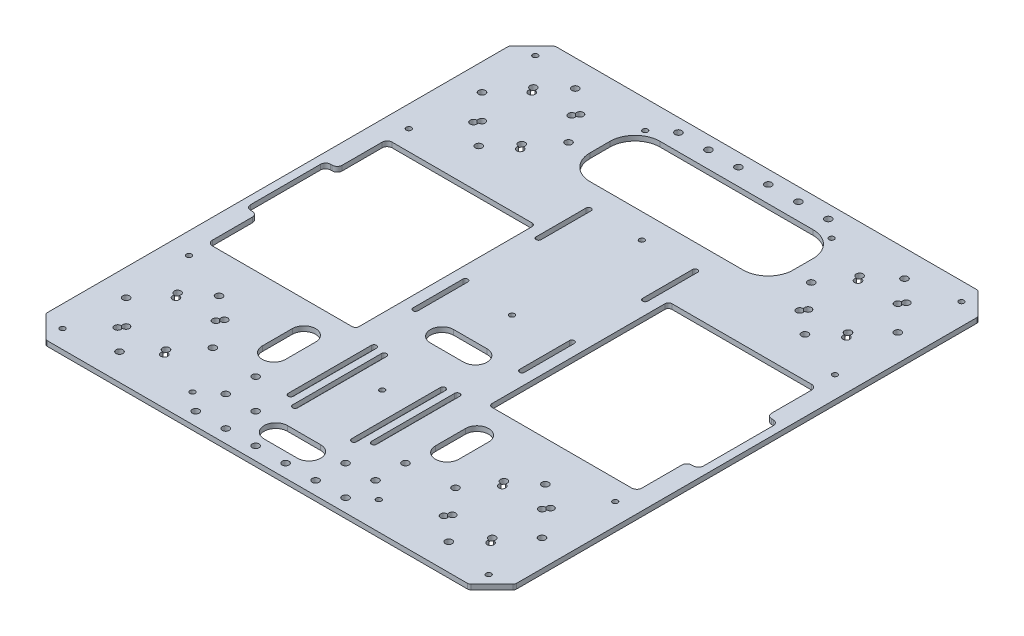
from build123d import *

# Parameters (mm, degrees)
BASE_FLANGE1_START = -3
BASE_FLANGE1_DEPTH = 3
SKETCH6_R          = 1.55
SKETCH6_R_2        = 2.05
CUT_EXTRUDE1_DEPTH = 10
FILLET1_R          = 3
SKETCH7_R          = 2.05
CUT_EXTRUDE2_DEPTH = 10


# Read off the part's stored shape, not the designer's step: Base-Flange1
with BuildPart() as part:
    # Base-Flange1 outline → Base-Flange1 (new body)
    with BuildSketch(Plane(origin=(0, 0, 0), x_dir=(1, 0, 0), z_dir=(0, 1, 0)).offset(BASE_FLANGE1_START)):
        with BuildLine():
            Line((140.314213562, 139.644870145), (127.644870145, 152.314213562))
            ThreePointArc((127.644870145, 152.314213562), (126.996023447, 152.747759065), (126.230656582, 152.9))
            Line((126.230656582, 152.9), (-126.230656582, 152.9))
            ThreePointArc((-126.230656582, 152.9), (-126.996023447, 152.747759065), (-127.644870145, 152.314213562))
            Line((-127.644870145, 152.314213562), (-140.314213562, 139.644870145))
            ThreePointArc((-140.314213562, 139.644870145), (-140.747759065, 138.996023447), (-140.9, 138.230656582))
            Line((-140.9, 138.230656582), (-140.9, -138.230656582))
            ThreePointArc((-140.9, -138.230656582), (-140.747759065, -138.996023447), (-140.314213562, -139.644870145))
            Line((-140.314213562, -139.644870145), (-127.644870145, -152.314213562))
            ThreePointArc((-127.644870145, -152.314213562), (-126.996023447, -152.747759065), (-126.230656582, -152.9))
            Line((-126.230656582, -152.9), (126.230656582, -152.9))
            ThreePointArc((126.230656582, -152.9), (126.996023447, -152.747759065), (127.644870145, -152.314213562))
            Line((127.644870145, -152.314213562), (140.314213562, -139.644870145))
            ThreePointArc((140.314213562, -139.644870145), (140.747759065, -138.996023447), (140.9, -138.230656582))
            Line((140.9, -138.230656582), (140.9, 138.230656582))
            ThreePointArc((140.9, 138.230656582), (140.747759065, 138.996023447), (140.314213562, 139.644870145))
        make_face()
        with BuildLine():
            ThreePointArc((-42, 54), (-40.585786438, 53.414213562), (-40, 52))
            Line((-40, 52), (-40, -52))
            ThreePointArc((-40, -52), (-40.585786438, -53.414213562), (-42, -54))
            Line((-42, -54), (-129, -54))
            Line((-129, -54), (-129, -24))
            Line((-129, -24), (-136, -24))
            Line((-136, -24), (-136, 24))
            Line((-136, 24), (-129, 24))
            Line((-129, 24), (-129, 54))
            Line((-129, 54), (-42, 54))
        make_face(mode=Mode.SUBTRACT)
        with BuildLine():
            ThreePointArc((40, 52), (40.585786438, 53.414213562), (42, 54))
            Line((42, 54), (129, 54))
            Line((129, 54), (129, 24))
            Line((129, 24), (136, 24))
            Line((136, 24), (136, -24))
            Line((136, -24), (129, -24))
            Line((129, -24), (129, -54))
            Line((129, -54), (42, -54))
            ThreePointArc((42, -54), (40.585786438, -53.414213562), (40, -52))
            Line((40, -52), (40, 52))
        make_face(mode=Mode.SUBTRACT)
    extrude(amount=BASE_FLANGE1_DEPTH)

    # Sketch6 → Cut-Extrude1 (cut)
    with BuildSketch(Plane(origin=(0, 0, 0), x_dir=(1, 0, 0), z_dir=(0, 1, 0))):
        with Locations(Location((128, 142, 0), (0, 0, 270))):
            Circle(SKETCH6_R)
        with Locations(Location((56, 136, 0), (0, 0, 270))):
            Circle(SKETCH6_R)
        with Locations(Location((128, 66, 0), (0, 0, 270))):
            Circle(SKETCH6_R)
        with Locations(Location((0, 78, 0), (0, 0, 270))):
            Circle(SKETCH6_R)
        with Locations(Location((128, -142, 0), (0, 0, 270))):
            Circle(SKETCH6_R)
        with Locations(Location((128, -66, 0), (0, 0, 270))):
            Circle(SKETCH6_R)
        with Locations(Location((56, -136, 0), (0, 0, 270))):
            Circle(SKETCH6_R)
        with Locations(Location((0, -78, 0), (0, 0, 270))):
            Circle(SKETCH6_R)
        with Locations(Location((-56, -136, 0), (0, 0, 270))):
            Circle(SKETCH6_R)
        with Locations(Location((-128, -66, 0), (0, 0, 270))):
            Circle(SKETCH6_R)
        with Locations(Location((-128, -142, 0), (0, 0, 270))):
            Circle(SKETCH6_R)
        with Locations(Location((-128, 66, 0), (0, 0, 270))):
            Circle(SKETCH6_R)
        with Locations(Location((-56, 136, 0), (0, 0, 270))):
            Circle(SKETCH6_R)
        with Locations(Location((-128, 142, 0), (0, 0, 270))):
            Circle(SKETCH6_R)
        with Locations(Location((0, 0, 0), (0, 0, 270))):
            Circle(SKETCH6_R)
        with Locations(Location((-98, 78, 0), (0, 0, 270))):
            Circle(SKETCH6_R_2)
        with Locations(Location((-72.9, 106.869078783, 0), (0, 0, 270))):
            Circle(SKETCH6_R_2)
        with Locations(Location((-124.9, 106.869078783, 0), (0, 0, 270))):
            Circle(SKETCH6_R_2)
        with Locations(Location((124.9, 106.869078783, 0), (0, 0, 270))):
            Circle(SKETCH6_R_2)
        with Locations(Location((72.9, 106.869078783, 0), (0, 0, 270))):
            Circle(SKETCH6_R_2)
        with Locations(Location((98, 78, 0), (0, 0, 270))):
            Circle(SKETCH6_R_2)
        with Locations(Location((-124.9, -106.869078783, 0), (0, 0, 270))):
            Circle(SKETCH6_R_2)
        with Locations(Location((-98, -78, 0), (0, 0, 270))):
            Circle(SKETCH6_R_2)
        with Locations(Location((-72.9, -106.869078783, 0), (0, 0, 270))):
            Circle(SKETCH6_R_2)
        with Locations(Location((72.9, -106.869078783, 0), (0, 0, 270))):
            Circle(SKETCH6_R_2)
        with Locations(Location((98, -78, 0), (0, 0, 270))):
            Circle(SKETCH6_R_2)
        with Locations(Location((124.9, -106.869078783, 0), (0, 0, 270))):
            Circle(SKETCH6_R_2)
        with Locations(Location((-98.9, 136.9, 0), (0, 0, 270))):
            Circle(SKETCH6_R_2)
        with Locations(Location((98.9, 136.9, 0), (0, 0, 270))):
            Circle(SKETCH6_R_2)
        with Locations(Location((98.9, -136.9, 0), (0, 0, 270))):
            Circle(SKETCH6_R_2)
        with Locations(Location((-98.9, -136.9, 0), (0, 0, 270))):
            Circle(SKETCH6_R_2)
        with BuildLine():
            Line((-46, 92.9), (46, 92.9))
            ThreePointArc((46, 92.9), (56.606601718, 97.293398282), (61, 107.9))
            Line((61, 107.9), (61, 119.9))
            ThreePointArc((61, 119.9), (56.606601718, 130.506601718), (46, 134.9))
            Line((46, 134.9), (-46, 134.9))
            ThreePointArc((-46, 134.9), (-56.606601718, 130.506601718), (-61, 119.9))
            Line((-61, 119.9), (-61, 107.9))
            ThreePointArc((-61, 107.9), (-56.606601718, 97.293398282), (-46, 92.9))
        make_face()
        with BuildLine():
            Line((-30.5, 78), (-30.5, 48))
            ThreePointArc((-30.5, 48), (-32, 46.5), (-33.5, 48))
            Line((-33.5, 48), (-33.5, 78))
            ThreePointArc((-33.5, 78), (-32, 79.5), (-30.5, 78))
        make_face()
        with BuildLine():
            Line((30.5, 78), (30.5, 48))
            ThreePointArc((30.5, 48), (32, 46.5), (33.5, 48))
            Line((33.5, 48), (33.5, 78))
            ThreePointArc((33.5, 78), (32, 79.5), (30.5, 78))
        make_face()
        with BuildLine():
            Line((-30.5, 4), (-30.5, -26))
            ThreePointArc((-30.5, -26), (-32, -27.5), (-33.5, -26))
            Line((-33.5, -26), (-33.5, 4))
            ThreePointArc((-33.5, 4), (-32, 5.5), (-30.5, 4))
        make_face()
        with BuildLine():
            Line((30.5, 4), (30.5, -26))
            ThreePointArc((30.5, -26), (32, -27.5), (33.5, -26))
            Line((33.5, -26), (33.5, 4))
            ThreePointArc((33.5, 4), (32, 5.5), (30.5, 4))
        make_face()
        with BuildLine():
            Line((19.22766953, -59.22233047), (19.22766953, -112.57766953))
            ThreePointArc((19.22766953, -112.57766953), (17.67766953, -114.12766953), (16.12766953, -112.57766953))
            Line((16.12766953, -112.57766953), (16.12766953, -59.22233047))
            ThreePointArc((16.12766953, -59.22233047), (17.67766953, -57.67233047), (19.22766953, -59.22233047))
        make_face()
        with BuildLine():
            Line((-19.22766953, -59.22233047), (-19.22766953, -112.57766953))
            ThreePointArc((-19.22766953, -112.57766953), (-17.67766953, -114.12766953), (-16.12766953, -112.57766953))
            Line((-16.12766953, -112.57766953), (-16.12766953, -59.22233047))
            ThreePointArc((-16.12766953, -59.22233047), (-17.67766953, -57.67233047), (-19.22766953, -59.22233047))
        make_face()
        with BuildLine():
            Line((-26.55, -107.9), (-26.55, -57.9))
            ThreePointArc((-26.55, -57.9), (-25, -56.35), (-23.45, -57.9))
            Line((-23.45, -57.9), (-23.45, -107.9))
            ThreePointArc((-23.45, -107.9), (-25, -109.45), (-26.55, -107.9))
        make_face()
        with BuildLine():
            Line((26.55, -107.9), (26.55, -57.9))
            ThreePointArc((26.55, -57.9), (25, -56.35), (23.45, -57.9))
            Line((23.45, -57.9), (23.45, -107.9))
            ThreePointArc((23.45, -107.9), (25, -109.45), (26.55, -107.9))
        make_face()
        with BuildLine():
            ThreePointArc((110.187951309, 123.910444577), (108.862864598, 120.16337568), (111.812048691, 122.827712989))
            ThreePointArc((111.812048691, 122.827712989), (113.137135402, 126.574781887), (110.187951309, 123.910444577))
        make_face()
        with BuildLine():
            ThreePointArc((110.187951309, 89.827712989), (108.862864598, 93.574781887), (111.812048691, 90.910444577))
            ThreePointArc((111.812048691, 90.910444577), (113.137135402, 87.16337568), (110.187951309, 89.827712989))
        make_face()
        with BuildLine():
            ThreePointArc((85.812048691, 89.827712989), (87.137135402, 93.574781887), (84.187951309, 90.910444577))
            ThreePointArc((84.187951309, 90.910444577), (82.862864598, 87.16337568), (85.812048691, 89.827712989))
        make_face()
        with BuildLine():
            ThreePointArc((85.812048691, 123.910444577), (87.137135402, 120.16337568), (84.187951309, 122.827712989))
            ThreePointArc((84.187951309, 122.827712989), (82.862864598, 126.574781887), (85.812048691, 123.910444577))
        make_face()
        with BuildLine():
            ThreePointArc((110.187951309, -89.827712989), (108.862864598, -93.574781887), (111.812048691, -90.910444577))
            ThreePointArc((111.812048691, -90.910444577), (113.137135402, -87.16337568), (110.187951309, -89.827712989))
        make_face()
        with BuildLine():
            ThreePointArc((84.187951309, -90.910444577), (82.862864598, -87.16337568), (85.812048691, -89.827712989))
            ThreePointArc((85.812048691, -89.827712989), (87.137135402, -93.574781887), (84.187951309, -90.910444577))
        make_face()
        with BuildLine():
            ThreePointArc((110.187951309, -123.910444577), (108.862864598, -120.16337568), (111.812048691, -122.827712989))
            ThreePointArc((111.812048691, -122.827712989), (113.137135402, -126.574781887), (110.187951309, -123.910444577))
        make_face()
        with BuildLine():
            ThreePointArc((84.187951309, -122.827712989), (82.862864598, -126.574781887), (85.812048691, -123.910444577))
            ThreePointArc((85.812048691, -123.910444577), (87.137135402, -120.16337568), (84.187951309, -122.827712989))
        make_face()
        with BuildLine():
            ThreePointArc((-85.812048691, -123.910444577), (-87.137135402, -120.16337568), (-84.187951309, -122.827712989))
            ThreePointArc((-84.187951309, -122.827712989), (-82.862864598, -126.574781887), (-85.812048691, -123.910444577))
        make_face()
        with BuildLine():
            ThreePointArc((-111.812048691, -122.827712989), (-113.137135402, -126.574781887), (-110.187951309, -123.910444577))
            ThreePointArc((-110.187951309, -123.910444577), (-108.862864598, -120.16337568), (-111.812048691, -122.827712989))
        make_face()
        with BuildLine():
            ThreePointArc((-111.812048691, -90.910444577), (-113.137135402, -87.16337568), (-110.187951309, -89.827712989))
            ThreePointArc((-110.187951309, -89.827712989), (-108.862864598, -93.574781887), (-111.812048691, -90.910444577))
        make_face()
        with BuildLine():
            ThreePointArc((-85.812048691, -89.827712989), (-87.137135402, -93.574781887), (-84.187951309, -90.910444577))
            ThreePointArc((-84.187951309, -90.910444577), (-82.862864598, -87.16337568), (-85.812048691, -89.827712989))
        make_face()
        with BuildLine():
            ThreePointArc((-84.187951309, 90.910444577), (-82.862864598, 87.16337568), (-85.812048691, 89.827712989))
            ThreePointArc((-85.812048691, 89.827712989), (-87.137135402, 93.574781887), (-84.187951309, 90.910444577))
        make_face()
        with BuildLine():
            ThreePointArc((-110.187951309, 89.827712989), (-108.862864598, 93.574781887), (-111.812048691, 90.910444577))
            ThreePointArc((-111.812048691, 90.910444577), (-113.137135402, 87.16337568), (-110.187951309, 89.827712989))
        make_face()
        with BuildLine():
            ThreePointArc((-110.187951309, 123.910444577), (-108.862864598, 120.16337568), (-111.812048691, 122.827712989))
            ThreePointArc((-111.812048691, 122.827712989), (-113.137135402, 126.574781887), (-110.187951309, 123.910444577))
        make_face()
        with BuildLine():
            ThreePointArc((-84.187951309, 122.827712989), (-82.862864598, 126.574781887), (-85.812048691, 123.910444577))
            ThreePointArc((-85.812048691, 123.910444577), (-87.137135402, 120.16337568), (-84.187951309, 122.827712989))
        make_face()
    extrude(amount=-CUT_EXTRUDE1_DEPTH, mode=Mode.SUBTRACT)

    # Fillet1
    fillet1_edges = [part.edges().sort_by_distance(p)[0] for p in [
        (129, -1.5, -54),
        (129, -1.5, -24),
        (136, -1.5, -24),
        (136, -1.5, 24),
        (129, -1.5, 24),
        (129, -1.5, 54),
        (-129, -1.5, 54),
        (-129, -1.5, 24),
        (-136, -1.5, 24),
        (-136, -1.5, -24),
        (-129, -1.5, -24),
        (-129, -1.5, -54),
    ]]
    fillet(fillet1_edges, radius=FILLET1_R)

    # Sketch7 → Cut-Extrude2 (cut)
    with BuildSketch(Plane(origin=(0, 0, 0), x_dir=(1, 0, 0), z_dir=(0, 1, 0))):
        with Locations(Location((-27, -145, 0), (0, 0, 270))):
            Circle(SKETCH7_R)
        with Locations(Location((-9, -145, 0), (0, 0, 270))):
            Circle(SKETCH7_R)
        with Locations(Location((-27, -127, 0), (0, 0, 270))):
            Circle(SKETCH7_R)
        with Locations(Location((27, -127, 0), (0, 0, 270))):
            Circle(SKETCH7_R)
        with Locations(Location((9, -145, 0), (0, 0, 270))):
            Circle(SKETCH7_R)
        with Locations(Location((27, -145, 0), (0, 0, 270))):
            Circle(SKETCH7_R)
        with Locations(Location((27, 145, 0), (0, 0, 270))):
            Circle(SKETCH7_R)
        with Locations(Location((9, 145, 0), (0, 0, 270))):
            Circle(SKETCH7_R)
        with Locations(Location((-9, 145, 0), (0, 0, 270))):
            Circle(SKETCH7_R)
        with Locations(Location((-27, 145, 0), (0, 0, 270))):
            Circle(SKETCH7_R)
        with Locations(Location((-45, -145, 0), (0, 0, 270))):
            Circle(SKETCH7_R)
        with Locations(Location((-45, -127, 0), (0, 0, 270))):
            Circle(SKETCH7_R)
        with Locations(Location((45, -127, 0), (0, 0, 270))):
            Circle(SKETCH7_R)
        with Locations(Location((45, -145, 0), (0, 0, 270))):
            Circle(SKETCH7_R)
        with Locations(Location((-45, 145, 0), (0, 0, 270))):
            Circle(SKETCH7_R)
        with Locations(Location((45, 145, 0), (0, 0, 270))):
            Circle(SKETCH7_R)
        with Locations(Location((-45, -109, 0), (0, 0, 270))):
            Circle(SKETCH7_R)
        with Locations(Location((45, -109, 0), (0, 0, 270))):
            Circle(SKETCH7_R)
        with BuildLine():
            Line((-10, -25), (10, -25))
            ThreePointArc((10, -25), (17, -32), (10, -39))
            Line((10, -39), (-10, -39))
            ThreePointArc((-10, -39), (-17, -32), (-10, -25))
        make_face()
        with BuildLine():
            Line((-45, -73), (-45, -91))
            ThreePointArc((-45, -91), (-52, -98), (-59, -91))
            Line((-59, -91), (-59, -73))
            ThreePointArc((-59, -73), (-52, -66), (-45, -73))
        make_face()
        with BuildLine():
            Line((45, -73), (45, -91))
            ThreePointArc((45, -91), (52, -98), (59, -91))
            Line((59, -91), (59, -73))
            ThreePointArc((59, -73), (52, -66), (45, -73))
        make_face()
        with BuildLine():
            Line((-10, -124.9), (10, -124.9))
            ThreePointArc((10, -124.9), (17, -131.9), (10, -138.9))
            Line((10, -138.9), (-10, -138.9))
            ThreePointArc((-10, -138.9), (-17, -131.9), (-10, -124.9))
        make_face()
    extrude(amount=-CUT_EXTRUDE2_DEPTH, mode=Mode.SUBTRACT)


solid = part.part
